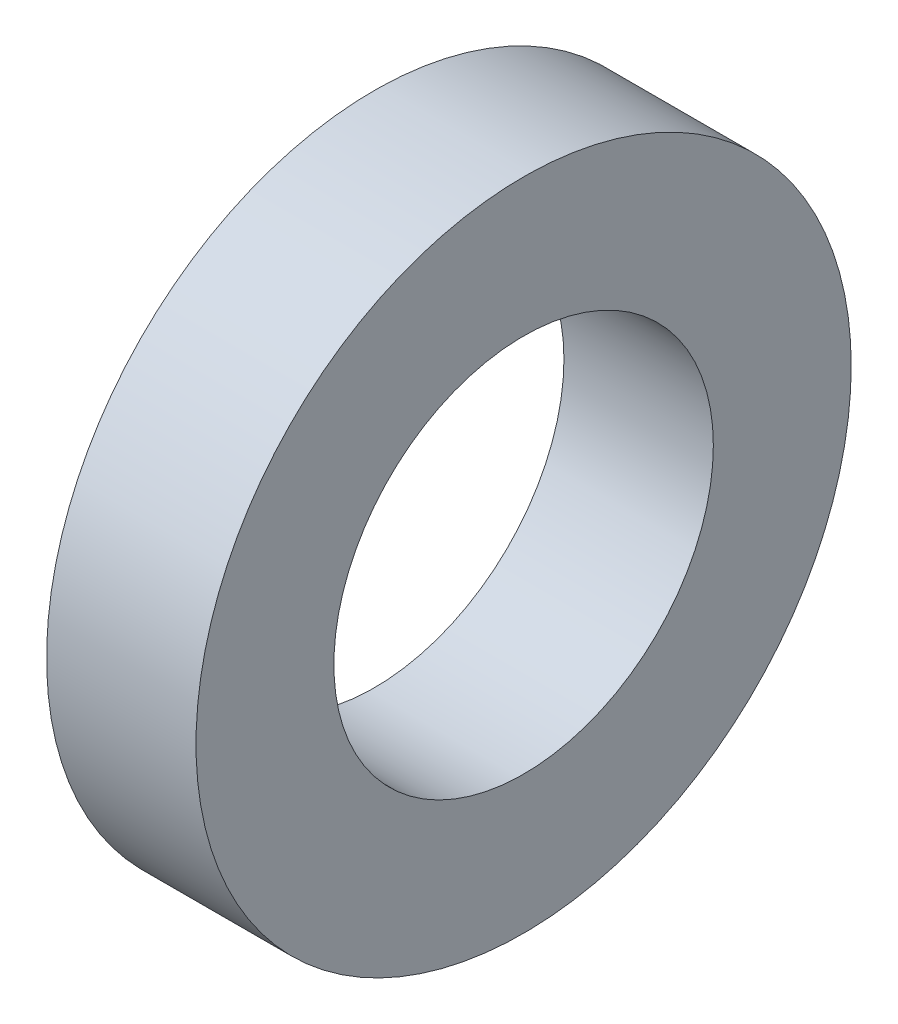
from build123d import *

# Parameters (mm, degrees)
SKETCH1_R           = 13.924461334
SKETCH1_R_2         = 8.0645
BOSS_EXTRUDE1_DEPTH = 6.35


with BuildPart() as part:
    # Sketch1 → Boss-Extrude1 (new body)
    with BuildSketch(Plane(origin=(0, 0, 0), x_dir=(0, 0, -1), z_dir=(1, 0, 0))):
        Circle(SKETCH1_R)
        Circle(SKETCH1_R_2, mode=Mode.SUBTRACT)
    extrude(amount=BOSS_EXTRUDE1_DEPTH)


solid = part.part
